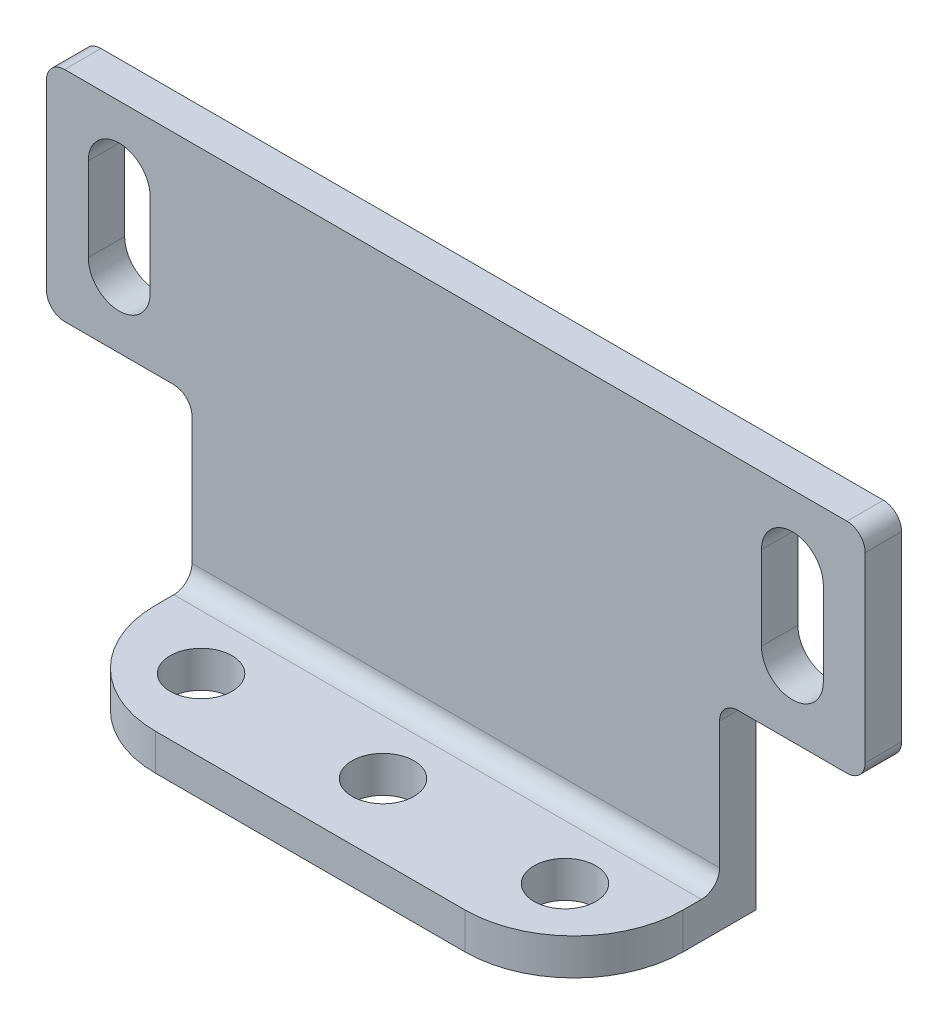
from build123d import *

# Parameters (mm, degrees)
SKETCH_1_W             = 45
SKETCH_1_H             = 10
EXTRUDE_1_DEPTH        = 2
SKETCH_2_W             = 45
SKETCH_2_H             = 23
EXTRUDE_2_DEPTH        = 2
SKETCH_4_W             = 45
SKETCH_4_H             = 2
EXTRUDE_3_DEPTH        = 10
PATTERN_LINEAR_1_COUNT = 3
PATTERN_LINEAR_1_PITCH = 10
HOLE_WIZARD_M3_2_DEPTH = 2
SKETCH_9_W             = 8
SKETCH_9_H             = 2
CUT_EXTRUDE_1_DEPTH    = 30.904013109
FILLET_1_R             = 6
FILLET_3_R             = 1
CUT_EXTRUDE_2_REACH    = 31.904
SKETCH_11_W            = 8
SKETCH_11_H            = 11
FILLET_5_R             = 1


# Read off the part's stored shape, not the designer's step: M3 间隙槽口2
with BuildPart() as part:
    # 草图1 → 凸台-拉伸1 (new body)
    with BuildSketch(Plane.XY):
        Rectangle(SKETCH_1_W, SKETCH_1_H)
    extrude(amount=EXTRUDE_1_DEPTH)

    # 草图2 → 凸台-拉伸2 (add)
    with BuildSketch(Plane.XY):
        with Locations((0, -6.5)):
            Rectangle(SKETCH_2_W, SKETCH_2_H)
    extrude(amount=EXTRUDE_2_DEPTH)

    # 草图4 → 凸台-拉伸3 (add)
    with BuildSketch(Plane.XY):
        with Locations((0, -17)):
            Rectangle(SKETCH_4_W, SKETCH_4_H)
    extrude(amount=EXTRUDE_3_DEPTH)

    # 草图6 → M3 间隙孔1 (revolve, cut)
    with BuildSketch(Plane(origin=(-10, -16, 6), x_dir=(0, 0, 1), z_dir=(1, 0, 0))):
        Polygon((0, 0), (0, 9.521463052), (1.7, 8.5), (1.7, 0), align=None)
    hole_wizard_m3_1 = revolve(axis=Axis((-10, -9.65, 6), (0, -1, 0)), mode=Mode.SUBTRACT)

    # 阵列(线性)1: M3 间隙孔1 ×3
    with Locations(*[(i * PATTERN_LINEAR_1_PITCH, 0, 0) for i in range(1, PATTERN_LINEAR_1_COUNT)]):
        add(hole_wizard_m3_1, mode=Mode.SUBTRACT)

    # M3 间隙槽口2 outline → M3 间隙槽口2 (cut)
    with BuildSketch(Plane.XY):
        with BuildLine():
            ThreePointArc((20.2, 1.3), (18.5, 3), (16.8, 1.3))
            Line((16.8, 1.3), (16.8, -3.3))
            ThreePointArc((16.8, -3.3), (18.5, -5), (20.2, -3.3))
            Line((20.2, -3.3), (20.2, 1.3))
        make_face()
        with BuildLine():
            ThreePointArc((-16.8, 1.3), (-18.5, 3), (-20.2, 1.3))
            Line((-20.2, 1.3), (-20.2, -3.3))
            ThreePointArc((-20.2, -3.3), (-18.5, -5), (-16.8, -3.3))
            Line((-16.8, -3.3), (-16.8, 1.3))
        make_face()
    extrude(amount=HOLE_WIZARD_M3_2_DEPTH, mode=Mode.SUBTRACT)

    # 草图9 → 切除-拉伸1 (cut, through all)
    with BuildSketch(Plane.XY.offset(2)):
        with Locations((-18.5, -17)):
            Rectangle(SKETCH_9_W, SKETCH_9_H)
        with Locations((18.5, -17)):
            Rectangle(SKETCH_9_W, SKETCH_9_H)
    extrude(amount=CUT_EXTRUDE_1_DEPTH, mode=Mode.SUBTRACT)

    # 圆角1
    fillet_1_edges = [part.edges().sort_by_distance(p)[0] for p in [
        (-14.5, -17, 10),
        (14.5, -17, 10),
    ]]
    fillet(fillet_1_edges, radius=FILLET_1_R)

    # 圆角3
    fillet_3_edges = [part.edges().sort_by_distance(p)[0] for p in [
        (0, -16, 2),
    ]]
    fillet(fillet_3_edges, radius=FILLET_3_R)

    # 草图11 → 切除-拉伸2 (cut, up to next)
    with BuildSketch(Plane.XY.offset(2), mode=Mode.PRIVATE) as cut_extrude_2_sk1:
        with Locations((-18.5, -12.5)):
            Rectangle(SKETCH_11_W, SKETCH_11_H)
    cut_extrude_2_tool1 = extrude(cut_extrude_2_sk1.sketch, amount=-CUT_EXTRUDE_2_REACH, mode=Mode.PRIVATE) & part.part
    cut_extrude_2 = cut_extrude_2_tool1.solids().sort_by_distance((-18.5, -12.5, 2))[0]
    add(cut_extrude_2, mode=Mode.SUBTRACT)

    # 镜向1: 切除-拉伸2 across plane
    add(cut_extrude_2.mirror(Plane(origin=(0, 0, 0), x_dir=(0, 0, 1), z_dir=(1, 0, 0))), mode=Mode.SUBTRACT)

    # 圆角5
    fillet_5_edges = [part.edges().sort_by_distance(p)[0] for p in [
        (-22.5, -7, 1),
        (-14.5, -7, 1),
        (22.5, -7, 1),
        (14.5, -7, 1),
        (-22.5, 5, 1),
        (22.5, 5, 1),
    ]]
    fillet(fillet_5_edges, radius=FILLET_5_R)


solid = part.part
